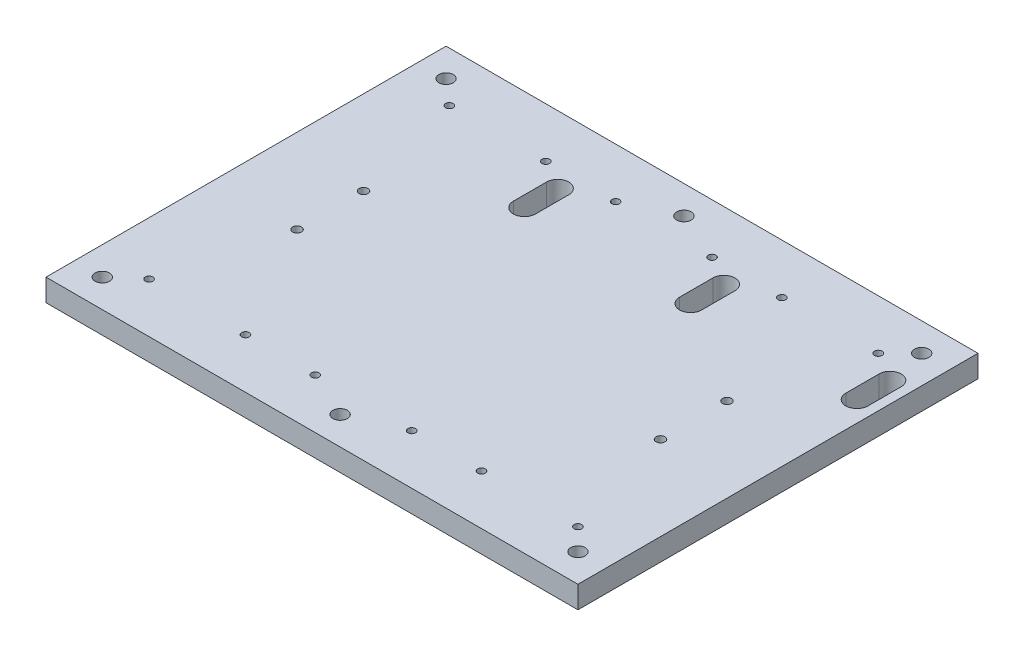
from build123d import *

# Parameters (mm, degrees)
SKETCH1_W           = 240
SKETCH1_H           = 180.5
BOSS_EXTRUDE1_DEPTH = 10
SKETCH1_5_R         = 1.7
CUT_EXTRUDE2_DEPTH  = 151.482764794
SKETCH2_W           = 140
SKETCH2_H           = 6
BOSS_EXTRUDE3_DEPTH = 30
SKETCH3_W           = 140
SKETCH3_H           = 10
BOSS_EXTRUDE4_DEPTH = 20
SKETCH4_R           = 2
CUT_EXTRUDE4_DEPTH  = 154.117805953
SKETCH7_R           = 3.25
CUT_EXTRUDE5_DEPTH  = 154.117805953
CUT_EXTRUDE6_DEPTH  = 156.386815721


with BuildPart() as part:
    # Sketch1 → Boss-Extrude1 (new body)
    with BuildSketch(Plane(origin=(0, 0, 0), x_dir=(1, 0, 0), z_dir=(0, 1, 0))):
        Rectangle(SKETCH1_W, SKETCH1_H)
    extrude(amount=-BOSS_EXTRUDE1_DEPTH)

    # Sketch1<5> → Cut-Extrude2 (cut, through all)
    with BuildSketch(Plane(origin=(0, 0, 0), x_dir=(1, 0, 0), z_dir=(0, 1, 0))):
        with Locations((-96, 67.75)):
            Circle(SKETCH1_5_R)
        with Locations((-96, -67.75)):
            Circle(SKETCH1_5_R)
        with Locations((-52.5, -67.75)):
            Circle(SKETCH1_5_R)
        with Locations((-52.5, 67.75)):
            Circle(SKETCH1_5_R)
        with Locations((-21, 67.75)):
            Circle(SKETCH1_5_R)
        with Locations((-21, -67.75)):
            Circle(SKETCH1_5_R)
        with Locations((22.5, -67.75)):
            Circle(SKETCH1_5_R)
        with Locations((22.5, 67.75)):
            Circle(SKETCH1_5_R)
        with Locations((54, 67.75)):
            Circle(SKETCH1_5_R)
        with Locations((54, -67.75)):
            Circle(SKETCH1_5_R)
        with Locations((97.5, -67.75)):
            Circle(SKETCH1_5_R)
        with Locations((97.5, 67.75)):
            Circle(SKETCH1_5_R)
    extrude(amount=-CUT_EXTRUDE2_DEPTH, mode=Mode.SUBTRACT)

    # Sketch2 → Boss-Extrude3 (add)
    with BuildSketch(Plane.XZ.offset(10)):
        Rectangle(SKETCH2_W, SKETCH2_H)
    extrude(amount=BOSS_EXTRUDE3_DEPTH)

    # Sketch3 → Boss-Extrude4 (add)
    with BuildSketch(Plane.XZ.offset(10)):
        Rectangle(SKETCH3_W, SKETCH3_H)
    extrude(amount=BOSS_EXTRUDE4_DEPTH)

    # Sketch4 → Cut-Extrude4 (cut, through all)
    with BuildSketch(Plane.XZ.offset(10)):
        with Locations((-82, 15)):
            Circle(SKETCH4_R)
        with Locations((82, 15)):
            Circle(SKETCH4_R)
        with Locations((82, -15)):
            Circle(SKETCH4_R)
        with Locations((-82, -15)):
            Circle(SKETCH4_R)
    extrude(amount=-CUT_EXTRUDE4_DEPTH, mode=Mode.SUBTRACT)

    # Sketch7 → Cut-Extrude5 (cut, through all)
    with BuildSketch(Plane.XZ.offset(10)):
        with Locations((-107.3, 77.55)):
            Circle(SKETCH7_R)
        with Locations((0, 77.55)):
            Circle(SKETCH7_R)
        with Locations((107.3, 77.55)):
            Circle(SKETCH7_R)
        with Locations((-107.3, -77.55)):
            Circle(SKETCH7_R)
        with Locations((0, -77.55)):
            Circle(SKETCH7_R)
        with Locations((107.3, -77.55)):
            Circle(SKETCH7_R)
    extrude(amount=-CUT_EXTRUDE5_DEPTH, mode=Mode.SUBTRACT)

    # Sketch9 → Cut-Extrude6 (cut, through all)
    with BuildSketch(Plane(origin=(0, 0, 0), x_dir=(1, 0, 0), z_dir=(0, 1, 0))):
        with BuildLine():
            Line((-34.25, 59.85), (-34.25, 44.85))
            ThreePointArc((-34.25, 44.85), (-39.25, 39.85), (-44.25, 44.85))
            Line((-44.25, 44.85), (-44.25, 59.85))
            ThreePointArc((-44.25, 59.85), (-39.25, 64.85), (-34.25, 59.85))
        make_face()
        with BuildLine():
            Line((40.75, 59.85), (40.75, 44.85))
            ThreePointArc((40.75, 44.85), (35.75, 39.85), (30.75, 44.85))
            Line((30.75, 44.85), (30.75, 59.85))
            ThreePointArc((30.75, 59.85), (35.75, 64.85), (40.75, 59.85))
        make_face()
        with BuildLine():
            Line((115.75, 59.85), (115.75, 44.85))
            ThreePointArc((115.75, 44.85), (110.75, 39.85), (105.75, 44.85))
            Line((105.75, 44.85), (105.75, 59.85))
            ThreePointArc((105.75, 59.85), (110.75, 64.85), (115.75, 59.85))
        make_face()
    extrude(amount=-CUT_EXTRUDE6_DEPTH, mode=Mode.SUBTRACT)


solid = part.part
